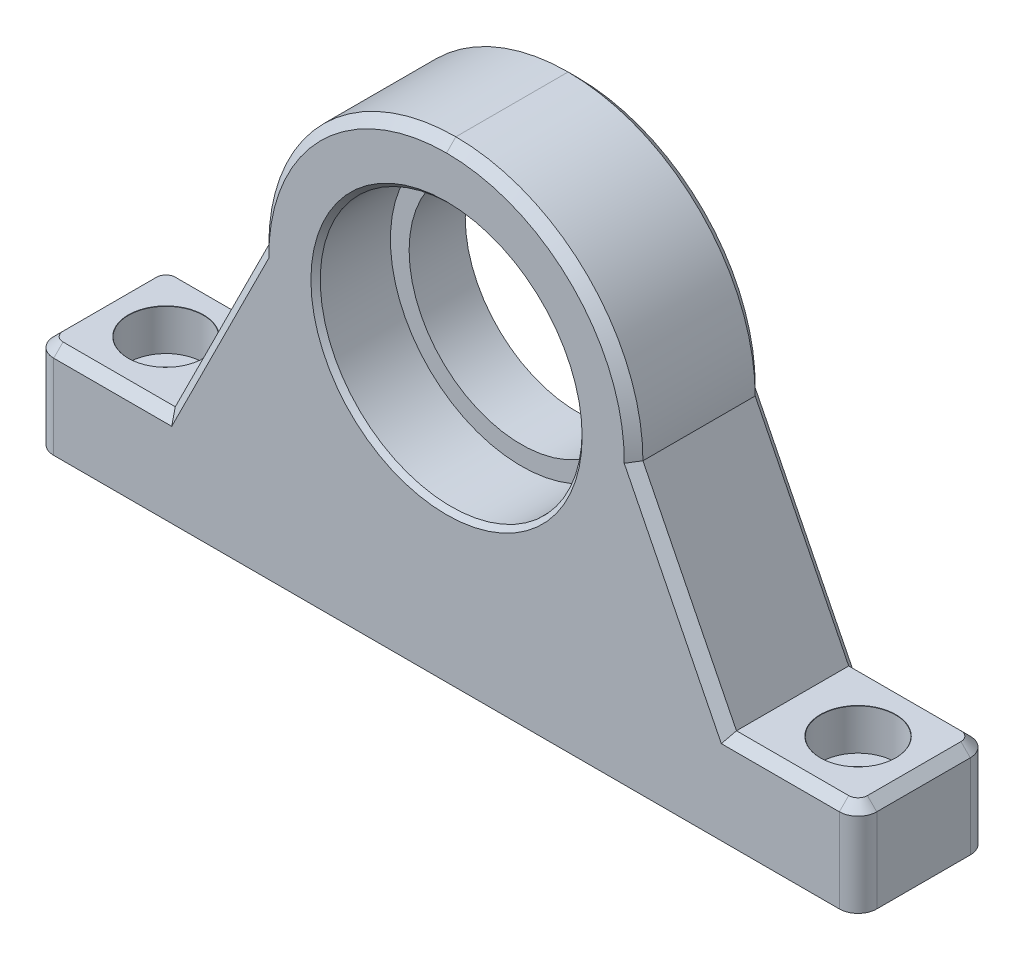
from build123d import *

# Parameters (mm, degrees)
BODY_DEPTH           = 14
TOP_FILLET_R         = 20
SIDE_FILLETS_R       = 2
DESIGN_CHAMFERS_SIZE = 1


# Read off the part's stored shape, not the designer's step: mounting_holes
with BuildPart() as part:
    # Sketch1 → body (new body)
    with BuildSketch(Plane.XY):
        Polygon((0, 0), (88, 0), (88, 10), (74, 10), (64, 30), (64, 50), (24, 50), (24, 30), (14, 10), (0, 10), align=None)
    extrude(amount=BODY_DEPTH)

    # top_fillet
    top_fillet_edges = [part.edges().sort_by_distance(p)[0] for p in [
        (24, 50, 7),
        (64, 50, 7),
    ]]
    fillet(top_fillet_edges, radius=TOP_FILLET_R - 0.0001)  # a hair under: the kernel refuses the full size

    # Sketch4 → bearing_hole (revolve, cut)
    with BuildSketch(Plane(origin=(44, 30, 14), x_dir=(0, -1, 0), z_dir=(1, 0, 0))):
        Polygon((0, 0), (0, 14), (12, 14), (12, 8), (14, 8), (14, 0.5), (14.5, 0), align=None)
    revolve(axis=Axis((44, 30, 20.35), (0, 0, -1)), mode=Mode.SUBTRACT)

    # mounting_holes outline → mounting_holes (revolve, cut)
    with BuildSketch(Plane(origin=(81, 0, 7), x_dir=(1, 0, 0), z_dir=(0, 0, 1))):
        Polygon((0, 0), (2.25, 0), (2.25, 5.6), (4, 5.6), (4, 9.975), (4.025, 10), (0, 10), align=None)
    revolve(axis=Axis((81, 0, 7), (0, 1, 0)), mode=Mode.SUBTRACT)

    # mounting_holes 2 outline → mounting_holes 2 (revolve, cut)
    with BuildSketch(Plane(origin=(7, 0, 7), x_dir=(1, 0, 0), z_dir=(0, 0, 1))):
        Polygon((0, 10), (0, 0), (2.25, 0), (2.25, 5.6), (4, 5.6), (4, 9.975), (4.025, 10), align=None)
    revolve(axis=Axis((7, 0, 7), (0, 1, 0)), mode=Mode.SUBTRACT)

    # side_fillets
    side_fillets_edges = [part.edges().sort_by_distance(p)[0] for p in [
        (88, 5, 14),
        (88, 5, 0),
        (0, 5, 0),
        (0, 5, 14),
    ]]
    fillet(side_fillets_edges, radius=SIDE_FILLETS_R)

    # design_chamfers
    design_chamfers_edges = [part.edges().sort_by_distance(p)[0] for p in [
        (8, 10, 0),
        (19, 20, 0),
        (69, 20, 0),
        (69, 20, 14),
        (58.142164913, 44.142164913, 0),
        (29.857835087, 44.142164913, 0),
        (58.142164913, 44.142164913, 14),
        (29.857835087, 44.142164913, 14),
        (19, 20, 14),
        (8, 10, 14),
        (0, 10, 7),
        (80, 10, 0),
        (0.585786438, 10, 13.414213562),
        (0.585786438, 10, 0.585786438),
        (88, 10, 7),
        (80, 10, 14),
        (87.414213562, 10, 13.414213562),
        (87.414213562, 10, 0.585786438),
    ]]
    chamfer(design_chamfers_edges, length=DESIGN_CHAMFERS_SIZE)


solid = part.part
